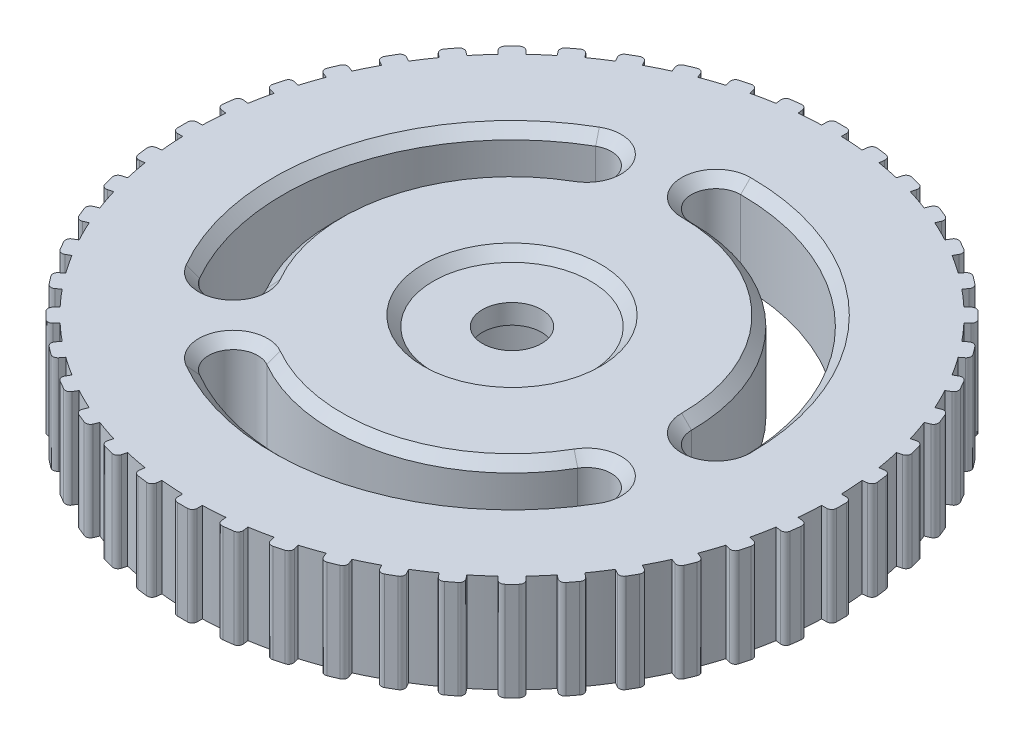
from build123d import *

# Parameters (mm, degrees)
SKETCH1_R              = 65
SKETCH1_R_2            = 18.5
BOSS_EXTRUDE1_DEPTH    = 20
BOSS_EXTRUDE1_2_DEPTH  = 20
BOSS_EXTRUDE1_3_DEPTH  = 20
BOSS_EXTRUDE1_4_DEPTH  = 20
BOSS_EXTRUDE1_5_DEPTH  = 20
BOSS_EXTRUDE1_6_DEPTH  = 20
BOSS_EXTRUDE1_7_DEPTH  = 20
BOSS_EXTRUDE1_8_DEPTH  = 20
BOSS_EXTRUDE1_9_DEPTH  = 20
BOSS_EXTRUDE1_10_DEPTH = 20
BOSS_EXTRUDE1_11_DEPTH = 20
BOSS_EXTRUDE1_12_DEPTH = 20
BOSS_EXTRUDE1_13_DEPTH = 20
BOSS_EXTRUDE1_14_DEPTH = 20
BOSS_EXTRUDE1_15_DEPTH = 20
BOSS_EXTRUDE1_16_DEPTH = 20
BOSS_EXTRUDE1_17_DEPTH = 20
BOSS_EXTRUDE1_18_DEPTH = 20
BOSS_EXTRUDE1_19_DEPTH = 20
BOSS_EXTRUDE1_20_DEPTH = 20
BOSS_EXTRUDE1_21_DEPTH = 20
BOSS_EXTRUDE1_22_DEPTH = 20
BOSS_EXTRUDE1_23_DEPTH = 20
BOSS_EXTRUDE1_24_DEPTH = 20
BOSS_EXTRUDE1_25_DEPTH = 20
BOSS_EXTRUDE1_26_DEPTH = 20
BOSS_EXTRUDE1_27_DEPTH = 20
BOSS_EXTRUDE1_28_DEPTH = 20
BOSS_EXTRUDE1_29_DEPTH = 20
BOSS_EXTRUDE1_30_DEPTH = 20
BOSS_EXTRUDE1_31_DEPTH = 20
BOSS_EXTRUDE1_32_DEPTH = 20
BOSS_EXTRUDE1_33_DEPTH = 20
BOSS_EXTRUDE1_34_DEPTH = 20
BOSS_EXTRUDE1_35_DEPTH = 20
BOSS_EXTRUDE1_36_DEPTH = 20
BOSS_EXTRUDE1_37_DEPTH = 20
BOSS_EXTRUDE1_38_DEPTH = 20
BOSS_EXTRUDE1_39_DEPTH = 20
BOSS_EXTRUDE1_40_DEPTH = 20
BOSS_EXTRUDE1_41_DEPTH = 20
BOSS_EXTRUDE1_42_DEPTH = 20
BOSS_EXTRUDE1_43_DEPTH = 20
BOSS_EXTRUDE1_44_DEPTH = 20
BOSS_EXTRUDE1_45_DEPTH = 20
BOSS_EXTRUDE1_46_DEPTH = 20
BOSS_EXTRUDE1_47_DEPTH = 20
BOSS_EXTRUDE1_48_DEPTH = 20
BOSS_EXTRUDE1_49_DEPTH = 20
SKETCH2_W              = 4
SKETCH2_H              = 1.896098486
SKETCH2_W_2            = 1.896098486
SKETCH2_H_2            = 4
BOSS_EXTRUDE2_DEPTH    = 20
SKETCH3_R              = 18.5
BOSS_EXTRUDE3_DEPTH    = 20
SKETCH4_R              = 17
CUT_EXTRUDE1_DEPTH     = 14
CHAMFER1_SIZE          = 6
SKETCH5_R              = 6
CUT_EXTRUDE2_DEPTH     = 14
SKETCH6_R              = 12
CUT_EXTRUDE3_DEPTH     = 2
CHAMFER2_SIZE          = 6
CUT_EXTRUDE4_DEPTH     = 20
CHAMFER3_SIZE          = 2


with BuildPart() as part:
    # Sketch1 → Boss-Extrude1 (new body)
    with BuildSketch(Plane(origin=(0, 0, 0), x_dir=(1, 0, 0), z_dir=(0, 1, 0))):
        with Locations(Location((0, 0, 0), (0, 0, 270))):
            Circle(SKETCH1_R)
        with Locations(Location((0, 0, 0), (0, 0, 270))):
            Circle(SKETCH1_R_2, mode=Mode.SUBTRACT)
    extrude(amount=BOSS_EXTRUDE1_DEPTH)



with BuildPart() as body_2:
    # Sketch1 → Boss-Extrude1 2 (new body)
    with BuildSketch(Plane(origin=(0, 0, 0), x_dir=(1, 0, 0), z_dir=(0, 1, 0))):
        with BuildLine():
            ThreePointArc((-31.267949192, -58.15767665), (-31.875155551, -58.623602476), (-32.633974596, -58.523702054))
            Line((-32.633974596, -58.523702054), (-34.366025404, -57.523702054))
            ThreePointArc((-34.366025404, -57.523702054), (-34.83195123, -56.916495695), (-34.732050808, -56.15767665))
            Line((-34.732050808, -56.15767665), (-34.232050808, -55.291651246))
            Line((-34.232050808, -55.291651246), (-32.5, -56.291651246))
            Line((-32.5, -56.291651246), (-30.767949192, -57.291651246))
            Line((-30.767949192, -57.291651246), (-31.267949192, -58.15767665))
        make_face()
    extrude(amount=BOSS_EXTRUDE1_2_DEPTH)


with BuildPart() as body_3:
    # Sketch1 → Boss-Extrude1 3 (new body)
    with BuildSketch(Plane(origin=(0, 0, 0), x_dir=(1, 0, 0), z_dir=(0, 1, 0))):
        with BuildLine():
            ThreePointArc((-38.591547634, -53.578843317), (-39.254374782, -53.96152675), (-39.993662403, -53.763435229))
            Line((-39.993662403, -53.763435229), (-41.580369084, -52.545912371))
            ThreePointArc((-41.580369084, -52.545912371), (-41.963052516, -51.883085222), (-41.764960995, -51.143797601))
            Line((-41.764960995, -51.143797601), (-41.156199566, -50.350444261))
            Line((-41.156199566, -50.350444261), (-39.569492886, -51.567967119))
            Line((-39.569492886, -51.567967119), (-37.982786205, -52.785489977))
            Line((-37.982786205, -52.785489977), (-38.591547634, -53.578843317))
        make_face()
    extrude(amount=BOSS_EXTRUDE1_3_DEPTH)


with BuildPart() as body_4:
    # Sketch1 → Boss-Extrude1 4 (new body)
    with BuildSketch(Plane(origin=(0, 0, 0), x_dir=(1, 0, 0), z_dir=(0, 1, 0))):
        with BuildLine():
            ThreePointArc((-23.409347471, -61.74141601), (-23.950543571, -62.282612111), (-24.715910436, -62.282612111))
            Line((-24.715910436, -62.282612111), (-26.563669501, -61.517245246))
            ThreePointArc((-26.563669501, -61.517245246), (-27.104865601, -60.976049146), (-27.104865601, -60.210682281))
            Line((-27.104865601, -60.210682281), (-26.722182169, -59.286802749))
            Line((-26.722182169, -59.286802749), (-24.874423104, -60.052169613))
            Line((-24.874423104, -60.052169613), (-23.026664039, -60.817536478))
            Line((-23.026664039, -60.817536478), (-23.409347471, -61.74141601))
        make_face()
    extrude(amount=BOSS_EXTRUDE1_4_DEPTH)


with BuildPart() as body_5:
    # Sketch1 → Boss-Extrude1 5 (new body)
    with BuildSketch(Plane(origin=(0, 0, 0), x_dir=(1, 0, 0), z_dir=(0, 1, 0))):
        with BuildLine():
            ThreePointArc((-15.150205324, -64.268742625), (-15.61613115, -64.875948984), (-16.374950196, -64.975849406))
            Line((-16.374950196, -64.975849406), (-18.306801848, -64.458211316))
            ThreePointArc((-18.306801848, -64.458211316), (-18.914008207, -63.99228549), (-19.013908629, -63.233466445))
            Line((-19.013908629, -63.233466445), (-18.755089584, -62.267540619))
            Line((-18.755089584, -62.267540619), (-16.823237932, -62.785178709))
            Line((-16.823237932, -62.785178709), (-14.891386279, -63.302816799))
            Line((-14.891386279, -63.302816799), (-15.150205324, -64.268742625))
        make_face()
    extrude(amount=BOSS_EXTRUDE1_5_DEPTH)


with BuildPart() as body_6:
    # Sketch1 → Boss-Extrude1 6 (new body)
    with BuildSketch(Plane(origin=(0, 0, 0), x_dir=(1, 0, 0), z_dir=(0, 1, 0))):
        with BuildLine():
            ThreePointArc((-6.631838964, -65.696413235), (-7.014522396, -66.359240383), (-7.753810017, -66.557331904))
            Line((-7.753810017, -66.557331904), (-9.73669974, -66.29627952))
            ThreePointArc((-9.73669974, -66.29627952), (-10.399526888, -65.913596087), (-10.597618409, -65.174308466))
            Line((-10.597618409, -65.174308466), (-10.467092217, -64.182863605))
            Line((-10.467092217, -64.182863605), (-8.484202494, -64.443915989))
            Line((-8.484202494, -64.443915989), (-6.501312772, -64.704968374))
            Line((-6.501312772, -64.704968374), (-6.631838964, -65.696413235))
        make_face()
    extrude(amount=BOSS_EXTRUDE1_6_DEPTH)


with BuildPart() as body_7:
    # Sketch1 → Boss-Extrude1 7 (new body)
    with BuildSketch(Plane(origin=(0, 0, 0), x_dir=(1, 0, 0), z_dir=(0, 1, 0))):
        with BuildLine():
            ThreePointArc((2, -66), (1.707106781, -66.707106781), (1, -67))
            Line((1, -67), (-1, -67))
            ThreePointArc((-1, -67), (-1.707106781, -66.707106781), (-2, -66))
            Line((-2, -66), (-2, -65))
            Line((-2, -65), (0, -65))
            Line((0, -65), (2, -65))
            Line((2, -65), (2, -66))
        make_face()
    extrude(amount=BOSS_EXTRUDE1_7_DEPTH)


with BuildPart() as body_8:
    # Sketch1 → Boss-Extrude1 8 (new body)
    with BuildSketch(Plane(origin=(0, 0, 0), x_dir=(1, 0, 0), z_dir=(0, 1, 0))):
        with BuildLine():
            ThreePointArc((10.597618409, -65.174308466), (10.399526888, -65.913596087), (9.73669974, -66.29627952))
            Line((9.73669974, -66.29627952), (7.753810017, -66.557331904))
            ThreePointArc((7.753810017, -66.557331904), (7.014522396, -66.359240383), (6.631838964, -65.696413235))
            Line((6.631838964, -65.696413235), (6.501312772, -64.704968374))
            Line((6.501312772, -64.704968374), (8.484202494, -64.443915989))
            Line((8.484202494, -64.443915989), (10.467092217, -64.182863605))
            Line((10.467092217, -64.182863605), (10.597618409, -65.174308466))
        make_face()
    extrude(amount=BOSS_EXTRUDE1_8_DEPTH)


with BuildPart() as body_9:
    # Sketch1 → Boss-Extrude1 9 (new body)
    with BuildSketch(Plane(origin=(0, 0, 0), x_dir=(1, 0, 0), z_dir=(0, 1, 0))):
        with BuildLine():
            ThreePointArc((27.104865601, -60.210682281), (27.104865601, -60.976049146), (26.563669501, -61.517245246))
            Line((26.563669501, -61.517245246), (24.715910436, -62.282612111))
            ThreePointArc((24.715910436, -62.282612111), (23.950543571, -62.282612111), (23.409347471, -61.74141601))
            Line((23.409347471, -61.74141601), (23.026664039, -60.817536478))
            Line((23.026664039, -60.817536478), (24.874423104, -60.052169613))
            Line((24.874423104, -60.052169613), (26.722182169, -59.286802749))
            Line((26.722182169, -59.286802749), (27.104865601, -60.210682281))
        make_face()
    extrude(amount=BOSS_EXTRUDE1_9_DEPTH)


with BuildPart() as body_10:
    # Sketch1 → Boss-Extrude1 10 (new body)
    with BuildSketch(Plane(origin=(0, 0, 0), x_dir=(1, 0, 0), z_dir=(0, 1, 0))):
        with BuildLine():
            ThreePointArc((34.732050808, -56.15767665), (34.83195123, -56.916495695), (34.366025404, -57.523702054))
            Line((34.366025404, -57.523702054), (32.633974596, -58.523702054))
            ThreePointArc((32.633974596, -58.523702054), (31.875155551, -58.623602476), (31.267949192, -58.15767665))
            Line((31.267949192, -58.15767665), (30.767949192, -57.291651246))
            Line((30.767949192, -57.291651246), (32.5, -56.291651246))
            Line((32.5, -56.291651246), (34.232050808, -55.291651246))
            Line((34.232050808, -55.291651246), (34.732050808, -56.15767665))
        make_face()
    extrude(amount=BOSS_EXTRUDE1_10_DEPTH)


with BuildPart() as body_11:
    # Sketch1 → Boss-Extrude1 11 (new body)
    with BuildSketch(Plane(origin=(0, 0, 0), x_dir=(1, 0, 0), z_dir=(0, 1, 0))):
        with BuildLine():
            ThreePointArc((41.764960995, -51.143797601), (41.963052516, -51.883085222), (41.580369084, -52.545912371))
            Line((41.580369084, -52.545912371), (39.993662403, -53.763435229))
            ThreePointArc((39.993662403, -53.763435229), (39.254374782, -53.96152675), (38.591547634, -53.578843317))
            Line((38.591547634, -53.578843317), (37.982786205, -52.785489977))
            Line((37.982786205, -52.785489977), (39.569492886, -51.567967119))
            Line((39.569492886, -51.567967119), (41.156199566, -50.350444261))
            Line((41.156199566, -50.350444261), (41.764960995, -51.143797601))
        make_face()
    extrude(amount=BOSS_EXTRUDE1_11_DEPTH)


with BuildPart() as body_12:
    # Sketch1 → Boss-Extrude1 12 (new body)
    with BuildSketch(Plane(origin=(0, 0, 0), x_dir=(1, 0, 0), z_dir=(0, 1, 0))):
        with BuildLine():
            ThreePointArc((48.083261121, -45.254833996), (48.37615434, -45.961940777), (48.083261121, -46.669047558))
            Line((48.083261121, -46.669047558), (46.669047558, -48.083261121))
            ThreePointArc((46.669047558, -48.083261121), (45.961940777, -48.376154339), (45.254833996, -48.083261121))
            Line((45.254833996, -48.083261121), (44.547727215, -47.376154339))
            Line((44.547727215, -47.376154339), (45.961940777, -45.961940777))
            Line((45.961940777, -45.961940777), (47.37615434, -44.547727215))
            Line((47.37615434, -44.547727215), (48.083261121, -45.254833996))
        make_face()
    extrude(amount=BOSS_EXTRUDE1_12_DEPTH)


with BuildPart() as body_13:
    # Sketch1 → Boss-Extrude1 13 (new body)
    with BuildSketch(Plane(origin=(0, 0, 0), x_dir=(1, 0, 0), z_dir=(0, 1, 0))):
        with BuildLine():
            ThreePointArc((53.578843317, -38.591547634), (53.96152675, -39.254374782), (53.763435229, -39.993662403))
            Line((53.763435229, -39.993662403), (52.545912371, -41.580369084))
            ThreePointArc((52.545912371, -41.580369084), (51.883085222, -41.963052516), (51.143797601, -41.764960995))
            Line((51.143797601, -41.764960995), (50.350444261, -41.156199566))
            Line((50.350444261, -41.156199566), (51.567967119, -39.569492886))
            Line((51.567967119, -39.569492886), (52.785489977, -37.982786205))
            Line((52.785489977, -37.982786205), (53.578843317, -38.591547634))
        make_face()
    extrude(amount=BOSS_EXTRUDE1_13_DEPTH)


with BuildPart() as body_14:
    # Sketch1 → Boss-Extrude1 14 (new body)
    with BuildSketch(Plane(origin=(0, 0, 0), x_dir=(1, 0, 0), z_dir=(0, 1, 0))):
        with BuildLine():
            ThreePointArc((58.15767665, -31.267949192), (58.623602476, -31.875155551), (58.523702054, -32.633974596))
            Line((58.523702054, -32.633974596), (57.523702054, -34.366025404))
            ThreePointArc((57.523702054, -34.366025404), (56.916495695, -34.83195123), (56.15767665, -34.732050808))
            Line((56.15767665, -34.732050808), (55.291651246, -34.232050808))
            Line((55.291651246, -34.232050808), (56.291651246, -32.5))
            Line((56.291651246, -32.5), (57.291651246, -30.767949192))
            Line((57.291651246, -30.767949192), (58.15767665, -31.267949192))
        make_face()
    extrude(amount=BOSS_EXTRUDE1_14_DEPTH)


with BuildPart() as body_15:
    # Sketch1 → Boss-Extrude1 15 (new body)
    with BuildSketch(Plane(origin=(0, 0, 0), x_dir=(1, 0, 0), z_dir=(0, 1, 0))):
        with BuildLine():
            ThreePointArc((61.74141601, -23.409347471), (62.282612111, -23.950543571), (62.282612111, -24.715910436))
            Line((62.282612111, -24.715910436), (61.517245246, -26.563669501))
            ThreePointArc((61.517245246, -26.563669501), (60.976049146, -27.104865601), (60.210682281, -27.104865601))
            Line((60.210682281, -27.104865601), (59.286802749, -26.722182169))
            Line((59.286802749, -26.722182169), (60.052169613, -24.874423104))
            Line((60.052169613, -24.874423104), (60.817536478, -23.026664039))
            Line((60.817536478, -23.026664039), (61.74141601, -23.409347471))
        make_face()
    extrude(amount=BOSS_EXTRUDE1_15_DEPTH)


with BuildPart() as body_16:
    # Sketch1 → Boss-Extrude1 16 (new body)
    with BuildSketch(Plane(origin=(0, 0, 0), x_dir=(1, 0, 0), z_dir=(0, 1, 0))):
        with BuildLine():
            ThreePointArc((64.268742625, -15.150205324), (64.875948984, -15.61613115), (64.975849406, -16.374950196))
            Line((64.975849406, -16.374950196), (64.458211316, -18.306801848))
            ThreePointArc((64.458211316, -18.306801848), (63.99228549, -18.914008207), (63.233466445, -19.013908629))
            Line((63.233466445, -19.013908629), (62.267540619, -18.755089584))
            Line((62.267540619, -18.755089584), (62.785178709, -16.823237932))
            Line((62.785178709, -16.823237932), (63.302816799, -14.891386279))
            Line((63.302816799, -14.891386279), (64.268742625, -15.150205324))
        make_face()
    extrude(amount=BOSS_EXTRUDE1_16_DEPTH)


with BuildPart() as body_17:
    # Sketch1 → Boss-Extrude1 17 (new body)
    with BuildSketch(Plane(origin=(0, 0, 0), x_dir=(1, 0, 0), z_dir=(0, 1, 0))):
        with BuildLine():
            ThreePointArc((65.696413235, -6.631838964), (66.359240383, -7.014522396), (66.557331904, -7.753810017))
            Line((66.557331904, -7.753810017), (66.29627952, -9.73669974))
            ThreePointArc((66.29627952, -9.73669974), (65.913596087, -10.399526888), (65.174308466, -10.597618409))
            Line((65.174308466, -10.597618409), (64.182863605, -10.467092217))
            Line((64.182863605, -10.467092217), (64.443915989, -8.484202494))
            Line((64.443915989, -8.484202494), (64.704968374, -6.501312772))
            Line((64.704968374, -6.501312772), (65.696413235, -6.631838964))
        make_face()
    extrude(amount=BOSS_EXTRUDE1_17_DEPTH)


with BuildPart() as body_18:
    # Sketch1 → Boss-Extrude1 18 (new body)
    with BuildSketch(Plane(origin=(0, 0, 0), x_dir=(1, 0, 0), z_dir=(0, 1, 0))):
        with BuildLine():
            ThreePointArc((66, 2), (66.707106781, 1.707106781), (67, 1))
            Line((67, 1), (67, -1))
            ThreePointArc((67, -1), (66.707106781, -1.707106781), (66, -2))
            Line((66, -2), (65, -2))
            Line((65, -2), (65, 0))
            Line((65, 0), (65, 2))
            Line((65, 2), (66, 2))
        make_face()
    extrude(amount=BOSS_EXTRUDE1_18_DEPTH)


with BuildPart() as body_19:
    # Sketch1 → Boss-Extrude1 19 (new body)
    with BuildSketch(Plane(origin=(0, 0, 0), x_dir=(1, 0, 0), z_dir=(0, 1, 0))):
        with BuildLine():
            ThreePointArc((65.174308466, 10.597618409), (65.913596087, 10.399526888), (66.29627952, 9.73669974))
            Line((66.29627952, 9.73669974), (66.557331904, 7.753810017))
            ThreePointArc((66.557331904, 7.753810017), (66.359240383, 7.014522396), (65.696413235, 6.631838964))
            Line((65.696413235, 6.631838964), (64.704968374, 6.501312772))
            Line((64.704968374, 6.501312772), (64.443915989, 8.484202494))
            Line((64.443915989, 8.484202494), (64.182863605, 10.467092217))
            Line((64.182863605, 10.467092217), (65.174308466, 10.597618409))
        make_face()
    extrude(amount=BOSS_EXTRUDE1_19_DEPTH)


with BuildPart() as body_20:
    # Sketch1 → Boss-Extrude1 20 (new body)
    with BuildSketch(Plane(origin=(0, 0, 0), x_dir=(1, 0, 0), z_dir=(0, 1, 0))):
        with BuildLine():
            ThreePointArc((60.210682281, 27.104865601), (60.976049146, 27.104865601), (61.517245246, 26.563669501))
            Line((61.517245246, 26.563669501), (62.282612111, 24.715910436))
            ThreePointArc((62.282612111, 24.715910436), (62.282612111, 23.950543571), (61.74141601, 23.409347471))
            Line((61.74141601, 23.409347471), (60.817536478, 23.026664039))
            Line((60.817536478, 23.026664039), (60.052169613, 24.874423104))
            Line((60.052169613, 24.874423104), (59.286802749, 26.722182169))
            Line((59.286802749, 26.722182169), (60.210682281, 27.104865601))
        make_face()
    extrude(amount=BOSS_EXTRUDE1_20_DEPTH)


with BuildPart() as body_21:
    # Sketch1 → Boss-Extrude1 21 (new body)
    with BuildSketch(Plane(origin=(0, 0, 0), x_dir=(1, 0, 0), z_dir=(0, 1, 0))):
        with BuildLine():
            ThreePointArc((56.15767665, 34.732050808), (56.916495695, 34.83195123), (57.523702054, 34.366025404))
            Line((57.523702054, 34.366025404), (58.523702054, 32.633974596))
            ThreePointArc((58.523702054, 32.633974596), (58.623602476, 31.875155551), (58.15767665, 31.267949192))
            Line((58.15767665, 31.267949192), (57.291651246, 30.767949192))
            Line((57.291651246, 30.767949192), (56.291651246, 32.5))
            Line((56.291651246, 32.5), (55.291651246, 34.232050808))
            Line((55.291651246, 34.232050808), (56.15767665, 34.732050808))
        make_face()
    extrude(amount=BOSS_EXTRUDE1_21_DEPTH)


with BuildPart() as body_22:
    # Sketch1 → Boss-Extrude1 22 (new body)
    with BuildSketch(Plane(origin=(0, 0, 0), x_dir=(1, 0, 0), z_dir=(0, 1, 0))):
        with BuildLine():
            ThreePointArc((51.143797601, 41.764960995), (51.883085222, 41.963052516), (52.545912371, 41.580369084))
            Line((52.545912371, 41.580369084), (53.763435229, 39.993662403))
            ThreePointArc((53.763435229, 39.993662403), (53.96152675, 39.254374782), (53.578843317, 38.591547634))
            Line((53.578843317, 38.591547634), (52.785489977, 37.982786205))
            Line((52.785489977, 37.982786205), (51.567967119, 39.569492886))
            Line((51.567967119, 39.569492886), (50.350444261, 41.156199566))
            Line((50.350444261, 41.156199566), (51.143797601, 41.764960995))
        make_face()
    extrude(amount=BOSS_EXTRUDE1_22_DEPTH)


with BuildPart() as body_23:
    # Sketch1 → Boss-Extrude1 23 (new body)
    with BuildSketch(Plane(origin=(0, 0, 0), x_dir=(1, 0, 0), z_dir=(0, 1, 0))):
        with BuildLine():
            ThreePointArc((45.254833996, 48.083261121), (45.961940777, 48.376154339), (46.669047558, 48.083261121))
            Line((46.669047558, 48.083261121), (48.083261121, 46.669047558))
            ThreePointArc((48.083261121, 46.669047558), (48.376154339, 45.961940777), (48.083261121, 45.254833996))
            Line((48.083261121, 45.254833996), (47.376154339, 44.547727215))
            Line((47.376154339, 44.547727215), (45.961940777, 45.961940777))
            Line((45.961940777, 45.961940777), (44.547727215, 47.376154339))
            Line((44.547727215, 47.376154339), (45.254833996, 48.083261121))
        make_face()
    extrude(amount=BOSS_EXTRUDE1_23_DEPTH)


with BuildPart() as body_24:
    # Sketch1 → Boss-Extrude1 24 (new body)
    with BuildSketch(Plane(origin=(0, 0, 0), x_dir=(1, 0, 0), z_dir=(0, 1, 0))):
        with BuildLine():
            ThreePointArc((38.591547634, 53.578843317), (39.254374782, 53.96152675), (39.993662403, 53.763435229))
            Line((39.993662403, 53.763435229), (41.580369084, 52.545912371))
            ThreePointArc((41.580369084, 52.545912371), (41.963052516, 51.883085222), (41.764960995, 51.143797601))
            Line((41.764960995, 51.143797601), (41.156199566, 50.350444261))
            Line((41.156199566, 50.350444261), (39.569492886, 51.567967119))
            Line((39.569492886, 51.567967119), (37.982786205, 52.785489977))
            Line((37.982786205, 52.785489977), (38.591547634, 53.578843317))
        make_face()
    extrude(amount=BOSS_EXTRUDE1_24_DEPTH)


with BuildPart() as body_25:
    # Sketch1 → Boss-Extrude1 25 (new body)
    with BuildSketch(Plane(origin=(0, 0, 0), x_dir=(1, 0, 0), z_dir=(0, 1, 0))):
        with BuildLine():
            ThreePointArc((31.267949192, 58.15767665), (31.875155551, 58.623602476), (32.633974596, 58.523702054))
            Line((32.633974596, 58.523702054), (34.366025404, 57.523702054))
            ThreePointArc((34.366025404, 57.523702054), (34.83195123, 56.916495695), (34.732050808, 56.15767665))
            Line((34.732050808, 56.15767665), (34.232050808, 55.291651246))
            Line((34.232050808, 55.291651246), (32.5, 56.291651246))
            Line((32.5, 56.291651246), (30.767949192, 57.291651246))
            Line((30.767949192, 57.291651246), (31.267949192, 58.15767665))
        make_face()
    extrude(amount=BOSS_EXTRUDE1_25_DEPTH)


with BuildPart() as body_26:
    # Sketch1 → Boss-Extrude1 26 (new body)
    with BuildSketch(Plane(origin=(0, 0, 0), x_dir=(1, 0, 0), z_dir=(0, 1, 0))):
        with BuildLine():
            ThreePointArc((23.409347471, 61.74141601), (23.950543571, 62.282612111), (24.715910436, 62.282612111))
            Line((24.715910436, 62.282612111), (26.563669501, 61.517245246))
            ThreePointArc((26.563669501, 61.517245246), (27.104865601, 60.976049146), (27.104865601, 60.210682281))
            Line((27.104865601, 60.210682281), (26.722182169, 59.286802749))
            Line((26.722182169, 59.286802749), (24.874423104, 60.052169613))
            Line((24.874423104, 60.052169613), (23.026664039, 60.817536478))
            Line((23.026664039, 60.817536478), (23.409347471, 61.74141601))
        make_face()
    extrude(amount=BOSS_EXTRUDE1_26_DEPTH)


with BuildPart() as body_27:
    # Sketch1 → Boss-Extrude1 27 (new body)
    with BuildSketch(Plane(origin=(0, 0, 0), x_dir=(1, 0, 0), z_dir=(0, 1, 0))):
        with BuildLine():
            ThreePointArc((15.150205324, 64.268742625), (15.61613115, 64.875948984), (16.374950196, 64.975849406))
            Line((16.374950196, 64.975849406), (18.306801848, 64.458211316))
            ThreePointArc((18.306801848, 64.458211316), (18.914008207, 63.99228549), (19.013908629, 63.233466445))
            Line((19.013908629, 63.233466445), (18.755089584, 62.267540619))
            Line((18.755089584, 62.267540619), (16.823237932, 62.785178709))
            Line((16.823237932, 62.785178709), (14.891386279, 63.302816799))
            Line((14.891386279, 63.302816799), (15.150205324, 64.268742625))
        make_face()
    extrude(amount=BOSS_EXTRUDE1_27_DEPTH)


with BuildPart() as body_28:
    # Sketch1 → Boss-Extrude1 28 (new body)
    with BuildSketch(Plane(origin=(0, 0, 0), x_dir=(1, 0, 0), z_dir=(0, 1, 0))):
        with BuildLine():
            ThreePointArc((6.631838964, 65.696413235), (7.014522396, 66.359240383), (7.753810017, 66.557331904))
            Line((7.753810017, 66.557331904), (9.73669974, 66.29627952))
            ThreePointArc((9.73669974, 66.29627952), (10.399526888, 65.913596087), (10.597618409, 65.174308466))
            Line((10.597618409, 65.174308466), (10.467092217, 64.182863605))
            Line((10.467092217, 64.182863605), (8.484202494, 64.443915989))
            Line((8.484202494, 64.443915989), (6.501312772, 64.704968374))
            Line((6.501312772, 64.704968374), (6.631838964, 65.696413235))
        make_face()
    extrude(amount=BOSS_EXTRUDE1_28_DEPTH)


with BuildPart() as body_29:
    # Sketch1 → Boss-Extrude1 29 (new body)
    with BuildSketch(Plane(origin=(0, 0, 0), x_dir=(1, 0, 0), z_dir=(0, 1, 0))):
        with BuildLine():
            ThreePointArc((1, 67), (1.707106781, 66.707106781), (2, 66))
            Line((2, 66), (2, 65))
            Line((2, 65), (0, 65))
            Line((0, 65), (-2, 65))
            Line((-2, 65), (-2, 66))
            ThreePointArc((-2, 66), (-1.707106781, 66.707106781), (-1, 67))
            Line((-1, 67), (1, 67))
        make_face()
    extrude(amount=BOSS_EXTRUDE1_29_DEPTH)


with BuildPart() as body_30:
    # Sketch1 → Boss-Extrude1 30 (new body)
    with BuildSketch(Plane(origin=(0, 0, 0), x_dir=(1, 0, 0), z_dir=(0, 1, 0))):
        with BuildLine():
            ThreePointArc((-10.597618409, 65.174308466), (-10.399526888, 65.913596087), (-9.73669974, 66.29627952))
            Line((-9.73669974, 66.29627952), (-7.753810017, 66.557331904))
            ThreePointArc((-7.753810017, 66.557331904), (-7.014522396, 66.359240383), (-6.631838964, 65.696413235))
            Line((-6.631838964, 65.696413235), (-6.501312772, 64.704968374))
            Line((-6.501312772, 64.704968374), (-8.484202494, 64.443915989))
            Line((-8.484202494, 64.443915989), (-10.467092217, 64.182863605))
            Line((-10.467092217, 64.182863605), (-10.597618409, 65.174308466))
        make_face()
    extrude(amount=BOSS_EXTRUDE1_30_DEPTH)


with BuildPart() as body_31:
    # Sketch1 → Boss-Extrude1 31 (new body)
    with BuildSketch(Plane(origin=(0, 0, 0), x_dir=(1, 0, 0), z_dir=(0, 1, 0))):
        with BuildLine():
            ThreePointArc((-19.013908629, 63.233466445), (-18.914008207, 63.99228549), (-18.306801848, 64.458211316))
            Line((-18.306801848, 64.458211316), (-16.374950196, 64.975849406))
            ThreePointArc((-16.374950196, 64.975849406), (-15.61613115, 64.875948984), (-15.150205324, 64.268742625))
            Line((-15.150205324, 64.268742625), (-14.891386279, 63.302816799))
            Line((-14.891386279, 63.302816799), (-16.823237932, 62.785178709))
            Line((-16.823237932, 62.785178709), (-18.755089584, 62.267540619))
            Line((-18.755089584, 62.267540619), (-19.013908629, 63.233466445))
        make_face()
    extrude(amount=BOSS_EXTRUDE1_31_DEPTH)


with BuildPart() as body_32:
    # Sketch1 → Boss-Extrude1 32 (new body)
    with BuildSketch(Plane(origin=(0, 0, 0), x_dir=(1, 0, 0), z_dir=(0, 1, 0))):
        with BuildLine():
            ThreePointArc((-41.764960995, 51.143797601), (-41.963052516, 51.883085222), (-41.580369084, 52.545912371))
            Line((-41.580369084, 52.545912371), (-39.993662403, 53.763435229))
            ThreePointArc((-39.993662403, 53.763435229), (-39.254374782, 53.96152675), (-38.591547634, 53.578843317))
            Line((-38.591547634, 53.578843317), (-37.982786205, 52.785489977))
            Line((-37.982786205, 52.785489977), (-39.569492886, 51.567967119))
            Line((-39.569492886, 51.567967119), (-41.156199566, 50.350444261))
            Line((-41.156199566, 50.350444261), (-41.764960995, 51.143797601))
        make_face()
    extrude(amount=BOSS_EXTRUDE1_32_DEPTH)


with BuildPart() as body_33:
    # Sketch1 → Boss-Extrude1 33 (new body)
    with BuildSketch(Plane(origin=(0, 0, 0), x_dir=(1, 0, 0), z_dir=(0, 1, 0))):
        with BuildLine():
            ThreePointArc((-34.732050808, 56.15767665), (-34.83195123, 56.916495695), (-34.366025404, 57.523702054))
            Line((-34.366025404, 57.523702054), (-32.633974596, 58.523702054))
            ThreePointArc((-32.633974596, 58.523702054), (-31.875155551, 58.623602476), (-31.267949192, 58.15767665))
            Line((-31.267949192, 58.15767665), (-30.767949192, 57.291651246))
            Line((-30.767949192, 57.291651246), (-32.5, 56.291651246))
            Line((-32.5, 56.291651246), (-34.232050808, 55.291651246))
            Line((-34.232050808, 55.291651246), (-34.732050808, 56.15767665))
        make_face()
    extrude(amount=BOSS_EXTRUDE1_33_DEPTH)


with BuildPart() as body_34:
    # Sketch1 → Boss-Extrude1 34 (new body)
    with BuildSketch(Plane(origin=(0, 0, 0), x_dir=(1, 0, 0), z_dir=(0, 1, 0))):
        with BuildLine():
            ThreePointArc((-27.104865601, 60.210682281), (-27.104865601, 60.976049146), (-26.563669501, 61.517245246))
            Line((-26.563669501, 61.517245246), (-24.715910436, 62.282612111))
            ThreePointArc((-24.715910436, 62.282612111), (-23.950543571, 62.282612111), (-23.409347471, 61.74141601))
            Line((-23.409347471, 61.74141601), (-23.026664039, 60.817536478))
            Line((-23.026664039, 60.817536478), (-24.874423104, 60.052169613))
            Line((-24.874423104, 60.052169613), (-26.722182169, 59.286802749))
            Line((-26.722182169, 59.286802749), (-27.104865601, 60.210682281))
        make_face()
    extrude(amount=BOSS_EXTRUDE1_34_DEPTH)


with BuildPart() as body_35:
    # Sketch1 → Boss-Extrude1 35 (new body)
    with BuildSketch(Plane(origin=(0, 0, 0), x_dir=(1, 0, 0), z_dir=(0, 1, 0))):
        with BuildLine():
            ThreePointArc((-53.578843317, 38.591547634), (-53.96152675, 39.254374782), (-53.763435229, 39.993662403))
            Line((-53.763435229, 39.993662403), (-52.545912371, 41.580369084))
            ThreePointArc((-52.545912371, 41.580369084), (-51.883085222, 41.963052516), (-51.143797601, 41.764960995))
            Line((-51.143797601, 41.764960995), (-50.350444261, 41.156199566))
            Line((-50.350444261, 41.156199566), (-51.567967119, 39.569492886))
            Line((-51.567967119, 39.569492886), (-52.785489977, 37.982786205))
            Line((-52.785489977, 37.982786205), (-53.578843317, 38.591547634))
        make_face()
    extrude(amount=BOSS_EXTRUDE1_35_DEPTH)


with BuildPart() as body_36:
    # Sketch1 → Boss-Extrude1 36 (new body)
    with BuildSketch(Plane(origin=(0, 0, 0), x_dir=(1, 0, 0), z_dir=(0, 1, 0))):
        with BuildLine():
            ThreePointArc((-48.083261121, 45.254833996), (-48.376154339, 45.961940777), (-48.083261121, 46.669047558))
            Line((-48.083261121, 46.669047558), (-46.669047558, 48.083261121))
            ThreePointArc((-46.669047558, 48.083261121), (-45.961940777, 48.376154339), (-45.254833996, 48.083261121))
            Line((-45.254833996, 48.083261121), (-44.547727215, 47.376154339))
            Line((-44.547727215, 47.376154339), (-45.961940777, 45.961940777))
            Line((-45.961940777, 45.961940777), (-47.376154339, 44.547727215))
            Line((-47.376154339, 44.547727215), (-48.083261121, 45.254833996))
        make_face()
    extrude(amount=BOSS_EXTRUDE1_36_DEPTH)


with BuildPart() as body_37:
    # Sketch1 → Boss-Extrude1 37 (new body)
    with BuildSketch(Plane(origin=(0, 0, 0), x_dir=(1, 0, 0), z_dir=(0, 1, 0))):
        with BuildLine():
            ThreePointArc((-58.15767665, 31.267949192), (-58.623602476, 31.875155551), (-58.523702054, 32.633974596))
            Line((-58.523702054, 32.633974596), (-57.523702054, 34.366025404))
            ThreePointArc((-57.523702054, 34.366025404), (-56.916495695, 34.83195123), (-56.15767665, 34.732050808))
            Line((-56.15767665, 34.732050808), (-55.291651246, 34.232050808))
            Line((-55.291651246, 34.232050808), (-56.291651246, 32.5))
            Line((-56.291651246, 32.5), (-57.291651246, 30.767949192))
            Line((-57.291651246, 30.767949192), (-58.15767665, 31.267949192))
        make_face()
    extrude(amount=BOSS_EXTRUDE1_37_DEPTH)


with BuildPart() as body_38:
    # Sketch1 → Boss-Extrude1 38 (new body)
    with BuildSketch(Plane(origin=(0, 0, 0), x_dir=(1, 0, 0), z_dir=(0, 1, 0))):
        with BuildLine():
            ThreePointArc((-65.696413235, 6.631838964), (-66.359240383, 7.014522396), (-66.557331904, 7.753810017))
            Line((-66.557331904, 7.753810017), (-66.29627952, 9.73669974))
            ThreePointArc((-66.29627952, 9.73669974), (-65.913596087, 10.399526888), (-65.174308466, 10.597618409))
            Line((-65.174308466, 10.597618409), (-64.182863605, 10.467092217))
            Line((-64.182863605, 10.467092217), (-64.443915989, 8.484202494))
            Line((-64.443915989, 8.484202494), (-64.704968374, 6.501312772))
            Line((-64.704968374, 6.501312772), (-65.696413235, 6.631838964))
        make_face()
    extrude(amount=BOSS_EXTRUDE1_38_DEPTH)


with BuildPart() as body_39:
    # Sketch1 → Boss-Extrude1 39 (new body)
    with BuildSketch(Plane(origin=(0, 0, 0), x_dir=(1, 0, 0), z_dir=(0, 1, 0))):
        with BuildLine():
            ThreePointArc((-66, -2), (-66.707106781, -1.707106781), (-67, -1))
            Line((-67, -1), (-67, 1))
            ThreePointArc((-67, 1), (-66.707106781, 1.707106781), (-66, 2))
            Line((-66, 2), (-65, 2))
            Line((-65, 2), (-65, 0))
            Line((-65, 0), (-65, -2))
            Line((-65, -2), (-66, -2))
        make_face()
    extrude(amount=BOSS_EXTRUDE1_39_DEPTH)


with BuildPart() as body_40:
    # Sketch1 → Boss-Extrude1 40 (new body)
    with BuildSketch(Plane(origin=(0, 0, 0), x_dir=(1, 0, 0), z_dir=(0, 1, 0))):
        with BuildLine():
            ThreePointArc((-65.174308466, -10.597618409), (-65.913596087, -10.399526888), (-66.29627952, -9.73669974))
            Line((-66.29627952, -9.73669974), (-66.557331904, -7.753810017))
            ThreePointArc((-66.557331904, -7.753810017), (-66.359240383, -7.014522396), (-65.696413235, -6.631838964))
            Line((-65.696413235, -6.631838964), (-64.704968374, -6.501312772))
            Line((-64.704968374, -6.501312772), (-64.443915989, -8.484202494))
            Line((-64.443915989, -8.484202494), (-64.182863605, -10.467092217))
            Line((-64.182863605, -10.467092217), (-65.174308466, -10.597618409))
        make_face()
    extrude(amount=BOSS_EXTRUDE1_40_DEPTH)


with BuildPart() as body_41:
    # Sketch1 → Boss-Extrude1 41 (new body)
    with BuildSketch(Plane(origin=(0, 0, 0), x_dir=(1, 0, 0), z_dir=(0, 1, 0))):
        with BuildLine():
            ThreePointArc((-63.233466445, -19.013908629), (-63.99228549, -18.914008207), (-64.458211316, -18.306801848))
            Line((-64.458211316, -18.306801848), (-64.975849406, -16.374950196))
            ThreePointArc((-64.975849406, -16.374950196), (-64.875948984, -15.61613115), (-64.268742625, -15.150205324))
            Line((-64.268742625, -15.150205324), (-63.302816799, -14.891386279))
            Line((-63.302816799, -14.891386279), (-62.785178709, -16.823237932))
            Line((-62.785178709, -16.823237932), (-62.267540619, -18.755089584))
            Line((-62.267540619, -18.755089584), (-63.233466445, -19.013908629))
        make_face()
    extrude(amount=BOSS_EXTRUDE1_41_DEPTH)


with BuildPart() as body_42:
    # Sketch1 → Boss-Extrude1 42 (new body)
    with BuildSketch(Plane(origin=(0, 0, 0), x_dir=(1, 0, 0), z_dir=(0, 1, 0))):
        with BuildLine():
            ThreePointArc((-60.210682281, -27.104865601), (-60.976049146, -27.104865601), (-61.517245246, -26.563669501))
            Line((-61.517245246, -26.563669501), (-62.282612111, -24.715910436))
            ThreePointArc((-62.282612111, -24.715910436), (-62.282612111, -23.950543571), (-61.74141601, -23.409347471))
            Line((-61.74141601, -23.409347471), (-60.817536478, -23.026664039))
            Line((-60.817536478, -23.026664039), (-60.052169613, -24.874423104))
            Line((-60.052169613, -24.874423104), (-59.286802749, -26.722182169))
            Line((-59.286802749, -26.722182169), (-60.210682281, -27.104865601))
        make_face()
    extrude(amount=BOSS_EXTRUDE1_42_DEPTH)


with BuildPart() as body_43:
    # Sketch1 → Boss-Extrude1 43 (new body)
    with BuildSketch(Plane(origin=(0, 0, 0), x_dir=(1, 0, 0), z_dir=(0, 1, 0))):
        with BuildLine():
            ThreePointArc((-56.15767665, -34.732050808), (-56.916495695, -34.83195123), (-57.523702054, -34.366025404))
            Line((-57.523702054, -34.366025404), (-58.523702054, -32.633974596))
            ThreePointArc((-58.523702054, -32.633974596), (-58.623602476, -31.875155551), (-58.15767665, -31.267949192))
            Line((-58.15767665, -31.267949192), (-57.291651246, -30.767949192))
            Line((-57.291651246, -30.767949192), (-56.291651246, -32.5))
            Line((-56.291651246, -32.5), (-55.291651246, -34.232050808))
            Line((-55.291651246, -34.232050808), (-56.15767665, -34.732050808))
        make_face()
    extrude(amount=BOSS_EXTRUDE1_43_DEPTH)


with BuildPart() as body_44:
    # Sketch1 → Boss-Extrude1 44 (new body)
    with BuildSketch(Plane(origin=(0, 0, 0), x_dir=(1, 0, 0), z_dir=(0, 1, 0))):
        with BuildLine():
            ThreePointArc((-51.143797601, -41.764960995), (-51.883085222, -41.963052516), (-52.545912371, -41.580369084))
            Line((-52.545912371, -41.580369084), (-53.763435229, -39.993662403))
            ThreePointArc((-53.763435229, -39.993662403), (-53.96152675, -39.254374782), (-53.578843317, -38.591547634))
            Line((-53.578843317, -38.591547634), (-52.785489977, -37.982786205))
            Line((-52.785489977, -37.982786205), (-51.567967119, -39.569492886))
            Line((-51.567967119, -39.569492886), (-50.350444261, -41.156199566))
            Line((-50.350444261, -41.156199566), (-51.143797601, -41.764960995))
        make_face()
    extrude(amount=BOSS_EXTRUDE1_44_DEPTH)


with BuildPart() as body_45:
    # Sketch1 → Boss-Extrude1 45 (new body)
    with BuildSketch(Plane(origin=(0, 0, 0), x_dir=(1, 0, 0), z_dir=(0, 1, 0))):
        with BuildLine():
            ThreePointArc((-45.254833996, -48.083261121), (-45.961940777, -48.37615434), (-46.669047558, -48.083261121))
            Line((-46.669047558, -48.083261121), (-48.083261121, -46.669047558))
            ThreePointArc((-48.083261121, -46.669047558), (-48.376154339, -45.961940777), (-48.083261121, -45.254833996))
            Line((-48.083261121, -45.254833996), (-47.376154339, -44.547727215))
            Line((-47.376154339, -44.547727215), (-45.961940777, -45.961940777))
            Line((-45.961940777, -45.961940777), (-44.547727215, -47.37615434))
            Line((-44.547727215, -47.37615434), (-45.254833996, -48.083261121))
        make_face()
    extrude(amount=BOSS_EXTRUDE1_45_DEPTH)


with BuildPart() as body_46:
    # Sketch1 → Boss-Extrude1 46 (new body)
    with BuildSketch(Plane(origin=(0, 0, 0), x_dir=(1, 0, 0), z_dir=(0, 1, 0))):
        with BuildLine():
            Line((16.823237932, -62.785178709), (14.891386279, -63.302816799))
            Line((14.891386279, -63.302816799), (15.150205324, -64.268742625))
            ThreePointArc((15.150205324, -64.268742625), (15.61613115, -64.875948984), (16.374950196, -64.975849406))
            Line((16.374950196, -64.975849406), (18.306801848, -64.458211316))
            ThreePointArc((18.306801848, -64.458211316), (18.914008207, -63.99228549), (19.013908629, -63.233466445))
            Line((19.013908629, -63.233466445), (18.755089584, -62.267540619))
            Line((18.755089584, -62.267540619), (16.823237932, -62.785178709))
        make_face()
    extrude(amount=BOSS_EXTRUDE1_46_DEPTH)


with BuildPart() as body_47:
    # Sketch1 → Boss-Extrude1 47 (new body)
    with BuildSketch(Plane(origin=(0, 0, 0), x_dir=(1, 0, 0), z_dir=(0, 1, 0))):
        with BuildLine():
            Line((62.785178709, 16.823237932), (63.302816799, 14.891386279))
            Line((63.302816799, 14.891386279), (64.268742625, 15.150205324))
            ThreePointArc((64.268742625, 15.150205324), (64.875948984, 15.61613115), (64.975849406, 16.374950196))
            Line((64.975849406, 16.374950196), (64.458211316, 18.306801848))
            ThreePointArc((64.458211316, 18.306801848), (63.99228549, 18.914008207), (63.233466445, 19.013908629))
            Line((63.233466445, 19.013908629), (62.267540619, 18.755089584))
            Line((62.267540619, 18.755089584), (62.785178709, 16.823237932))
        make_face()
    extrude(amount=BOSS_EXTRUDE1_47_DEPTH)


with BuildPart() as body_48:
    # Sketch1 → Boss-Extrude1 48 (new body)
    with BuildSketch(Plane(origin=(0, 0, 0), x_dir=(1, 0, 0), z_dir=(0, 1, 0))):
        with BuildLine():
            Line((-62.282612111, 24.715910436), (-61.517245246, 26.563669501))
            ThreePointArc((-61.517245246, 26.563669501), (-60.976049146, 27.104865601), (-60.210682281, 27.104865601))
            Line((-60.210682281, 27.104865601), (-59.286802749, 26.722182169))
            Line((-59.286802749, 26.722182169), (-60.052169613, 24.874423104))
            Line((-60.052169613, 24.874423104), (-60.817536478, 23.026664039))
            Line((-60.817536478, 23.026664039), (-61.74141601, 23.409347471))
            ThreePointArc((-61.74141601, 23.409347471), (-62.282612111, 23.950543571), (-62.282612111, 24.715910436))
        make_face()
    extrude(amount=BOSS_EXTRUDE1_48_DEPTH)


with BuildPart() as body_49:
    # Sketch1 → Boss-Extrude1 49 (new body)
    with BuildSketch(Plane(origin=(0, 0, 0), x_dir=(1, 0, 0), z_dir=(0, 1, 0))):
        with BuildLine():
            Line((-62.785178709, 16.823237932), (-63.302816799, 14.891386279))
            Line((-63.302816799, 14.891386279), (-64.268742625, 15.150205324))
            ThreePointArc((-64.268742625, 15.150205324), (-64.875948984, 15.61613115), (-64.975849406, 16.374950196))
            Line((-64.975849406, 16.374950196), (-64.458211316, 18.306801848))
            ThreePointArc((-64.458211316, 18.306801848), (-63.99228549, 18.914008207), (-63.233466445, 19.013908629))
            Line((-63.233466445, 19.013908629), (-62.267540619, 18.755089584))
            Line((-62.267540619, 18.755089584), (-62.785178709, 16.823237932))
        make_face()
    extrude(amount=BOSS_EXTRUDE1_49_DEPTH)


with BuildPart() as part_1:
    add(part.part)

    add(body_2.part)  # Boss-Extrude2 merges body 2

    add(body_3.part)  # Boss-Extrude2 merges body 3

    add(body_4.part)  # Boss-Extrude2 merges body 4

    add(body_5.part)  # Boss-Extrude2 merges body 5

    add(body_6.part)  # Boss-Extrude2 merges body 6

    add(body_7.part)  # Boss-Extrude2 merges body 7

    add(body_8.part)  # Boss-Extrude2 merges body 8

    add(body_9.part)  # Boss-Extrude2 merges body 9

    add(body_10.part)  # Boss-Extrude2 merges body 10

    add(body_11.part)  # Boss-Extrude2 merges body 11

    add(body_12.part)  # Boss-Extrude2 merges body 12

    add(body_13.part)  # Boss-Extrude2 merges body 13

    add(body_14.part)  # Boss-Extrude2 merges body 14

    add(body_15.part)  # Boss-Extrude2 merges body 15

    add(body_16.part)  # Boss-Extrude2 merges body 16

    add(body_17.part)  # Boss-Extrude2 merges body 17

    add(body_18.part)  # Boss-Extrude2 merges body 18

    add(body_19.part)  # Boss-Extrude2 merges body 19

    add(body_20.part)  # Boss-Extrude2 merges body 20

    add(body_21.part)  # Boss-Extrude2 merges body 21

    add(body_22.part)  # Boss-Extrude2 merges body 22

    add(body_23.part)  # Boss-Extrude2 merges body 23

    add(body_24.part)  # Boss-Extrude2 merges body 24

    add(body_25.part)  # Boss-Extrude2 merges body 25

    add(body_26.part)  # Boss-Extrude2 merges body 26

    add(body_27.part)  # Boss-Extrude2 merges body 27

    add(body_28.part)  # Boss-Extrude2 merges body 28

    add(body_29.part)  # Boss-Extrude2 merges body 29

    add(body_30.part)  # Boss-Extrude2 merges body 30

    add(body_31.part)  # Boss-Extrude2 merges body 31

    add(body_32.part)  # Boss-Extrude2 merges body 32

    add(body_33.part)  # Boss-Extrude2 merges body 33

    add(body_34.part)  # Boss-Extrude2 merges body 34

    add(body_35.part)  # Boss-Extrude2 merges body 35

    add(body_36.part)  # Boss-Extrude2 merges body 36

    add(body_37.part)  # Boss-Extrude2 merges body 37

    add(body_38.part)  # Boss-Extrude2 merges body 38

    add(body_39.part)  # Boss-Extrude2 merges body 39

    add(body_40.part)  # Boss-Extrude2 merges body 40

    add(body_41.part)  # Boss-Extrude2 merges body 41

    add(body_42.part)  # Boss-Extrude2 merges body 42

    add(body_43.part)  # Boss-Extrude2 merges body 43

    add(body_44.part)  # Boss-Extrude2 merges body 44

    add(body_45.part)  # Boss-Extrude2 merges body 45

    add(body_46.part)  # Boss-Extrude2 merges body 46

    add(body_47.part)  # Boss-Extrude2 merges body 47

    add(body_48.part)  # Boss-Extrude2 merges body 48

    add(body_49.part)  # Boss-Extrude2 merges body 49
    # Sketch2 → Boss-Extrude2 (add)
    with BuildSketch(Plane(origin=(0, 20, 0), x_dir=(1, 0, 0), z_dir=(0, 1, 0))):
        Polygon((6.501312772, 64.704968374), (6.253822256, 62.825091273), (10.219601702, 62.302986504), (10.467092217, 64.182863605), align=None)
        with Locations((0, 64.051950757)):
            Rectangle(SKETCH2_W, SKETCH2_H)
        Polygon((14.891386279, 63.302816799), (14.400639879, 61.471326302), (18.264343185, 60.436050121), (18.755089584, 62.267540619), align=None)
        Polygon((23.026664039, 60.817536478), (22.301058562, 59.065769895), (25.996576692, 57.535036165), (26.722182169, 59.286802749), align=None)
        Polygon((30.767949192, 57.291651246), (29.819899949, 55.649581789), (33.284001564, 53.649581789), (34.232050808, 55.291651246), align=None)
        Polygon((37.982786205, 52.785489977), (36.828514581, 51.281213909), (40.001927942, 48.846168193), (41.156199566, 50.350444261), align=None)
        Polygon((44.547727215, 47.37615434), (43.206983117, 46.035410242), (46.035410242, 43.206983117), (47.376154339, 44.547727215), align=None)
        Polygon((50.350444261, 41.156199566), (48.846168193, 40.001927942), (51.281213909, 36.828514581), (52.785489977, 37.982786205), align=None)
        Polygon((55.291651246, 34.232050808), (53.649581789, 33.284001564), (55.649581789, 29.819899949), (57.291651246, 30.767949192), align=None)
        Polygon((59.286802749, 26.722182169), (57.535036165, 25.996576692), (59.065769895, 22.301058562), (60.817536478, 23.026664039), align=None)
        Polygon((62.267540619, 18.755089584), (60.436050121, 18.264343185), (61.471326302, 14.400639879), (63.302816799, 14.891386279), align=None)
        Polygon((64.182863605, 10.467092217), (62.302986504, 10.219601702), (62.825091273, 6.253822256), (64.704968374, 6.501312772), align=None)
        with Locations((64.051950757, 0)):
            Rectangle(SKETCH2_W_2, SKETCH2_H_2)
        Polygon((64.704968374, -6.501312772), (62.825091273, -6.253822256), (62.302986504, -10.219601702), (64.182863605, -10.467092217), align=None)
        Polygon((63.302816799, -14.891386279), (61.471326302, -14.400639879), (60.436050121, -18.264343185), (62.267540619, -18.755089584), align=None)
        Polygon((60.817536478, -23.026664039), (59.065769895, -22.301058562), (57.535036165, -25.996576692), (59.286802749, -26.722182169), align=None)
        Polygon((57.291651246, -30.767949192), (55.649581789, -29.819899949), (53.649581789, -33.284001564), (55.291651246, -34.232050808), align=None)
        Polygon((52.785489977, -37.982786205), (51.281213909, -36.828514581), (48.846168193, -40.001927942), (50.350444261, -41.156199566), align=None)
        Polygon((47.37615434, -44.547727215), (46.035410242, -43.206983117), (43.206983117, -46.035410242), (44.547727215, -47.376154339), align=None)
        Polygon((41.156199566, -50.350444261), (40.001927942, -48.846168193), (36.828514581, -51.281213909), (37.982786205, -52.785489977), align=None)
        Polygon((34.232050808, -55.291651246), (33.284001564, -53.649581789), (29.819899949, -55.649581789), (30.767949192, -57.291651246), align=None)
        Polygon((26.722182169, -59.286802749), (25.996576692, -57.535036165), (22.301058562, -59.065769895), (23.026664039, -60.817536478), align=None)
        Polygon((18.755089584, -62.267540619), (18.264343185, -60.436050121), (14.400639879, -61.471326302), (14.891386279, -63.302816799), align=None)
        Polygon((10.467092217, -64.182863605), (10.219601702, -62.302986504), (6.253822256, -62.825091273), (6.501312772, -64.704968374), align=None)
        with Locations((0, -64.051950757)):
            Rectangle(SKETCH2_W, SKETCH2_H)
        Polygon((-6.501312772, -64.704968374), (-6.253822256, -62.825091273), (-10.219601702, -62.302986504), (-10.467092217, -64.182863605), align=None)
        Polygon((-14.891386279, -63.302816799), (-14.400639879, -61.471326302), (-18.264343185, -60.436050121), (-18.755089584, -62.267540619), align=None)
        Polygon((-23.026664039, -60.817536478), (-22.301058562, -59.065769895), (-25.996576692, -57.535036165), (-26.722182169, -59.286802749), align=None)
        Polygon((-30.767949192, -57.291651246), (-29.819899949, -55.649581789), (-33.284001564, -53.649581789), (-34.232050808, -55.291651246), align=None)
        Polygon((-37.982786205, -52.785489977), (-36.828514581, -51.281213909), (-40.001927942, -48.846168193), (-41.156199566, -50.350444261), align=None)
        Polygon((-44.547727215, -47.37615434), (-43.206983117, -46.035410242), (-46.035410242, -43.206983117), (-47.376154339, -44.547727215), align=None)
        Polygon((-50.350444261, -41.156199566), (-48.846168193, -40.001927942), (-51.281213909, -36.828514581), (-52.785489977, -37.982786205), align=None)
        Polygon((-55.291651246, -34.232050808), (-53.649581789, -33.284001564), (-55.649581789, -29.819899949), (-57.291651246, -30.767949192), align=None)
        Polygon((-59.286802748, -26.722182169), (-57.535036165, -25.996576692), (-59.065769895, -22.301058562), (-60.817536478, -23.026664039), align=None)
        Polygon((-62.267540619, -18.755089584), (-60.436050121, -18.264343185), (-61.471326302, -14.400639879), (-63.302816799, -14.891386279), align=None)
        Polygon((-64.182863605, -10.467092217), (-62.302986504, -10.219601702), (-62.825091273, -6.253822256), (-64.704968374, -6.501312772), align=None)
        with Locations((-64.051950757, 0)):
            Rectangle(SKETCH2_W_2, SKETCH2_H_2)
        Polygon((-64.704968374, 6.501312772), (-62.825091273, 6.253822256), (-62.302986504, 10.219601702), (-64.182863605, 10.467092217), align=None)
        Polygon((-63.302816799, 14.891386279), (-61.471326302, 14.400639879), (-60.436050121, 18.264343185), (-62.267540619, 18.755089584), align=None)
        Polygon((-60.817536478, 23.026664039), (-59.065769895, 22.301058562), (-57.535036165, 25.996576692), (-59.286802749, 26.722182169), align=None)
        Polygon((-57.291651246, 30.767949192), (-55.649581789, 29.819899949), (-53.649581789, 33.284001564), (-55.291651246, 34.232050808), align=None)
        Polygon((-52.785489977, 37.982786205), (-51.281213909, 36.828514581), (-48.846168193, 40.001927942), (-50.350444261, 41.156199566), align=None)
        Polygon((-47.376154339, 44.547727215), (-46.035410242, 43.206983117), (-43.206983117, 46.035410242), (-44.547727215, 47.376154339), align=None)
        Polygon((-41.156199566, 50.350444261), (-40.001927942, 48.846168193), (-36.828514581, 51.281213909), (-37.982786205, 52.785489977), align=None)
        Polygon((-34.232050808, 55.291651246), (-33.284001564, 53.649581789), (-29.819899949, 55.649581789), (-30.767949192, 57.291651246), align=None)
        Polygon((-26.722182169, 59.286802749), (-25.996576692, 57.535036165), (-22.301058562, 59.065769895), (-23.026664039, 60.817536478), align=None)
        Polygon((-18.755089584, 62.267540619), (-18.264343185, 60.436050121), (-14.400639879, 61.471326302), (-14.891386279, 63.302816799), align=None)
        Polygon((-10.467092217, 64.182863605), (-10.219601702, 62.302986504), (-6.253822256, 62.825091273), (-6.501312772, 64.704968374), align=None)
    extrude(amount=-BOSS_EXTRUDE2_DEPTH)

    # Sketch3 → Boss-Extrude3 (add)
    with BuildSketch(Plane.XZ):
        Circle(SKETCH3_R)
    extrude(amount=-BOSS_EXTRUDE3_DEPTH)

    # Sketch4 → Cut-Extrude1 (cut)
    with BuildSketch(Plane.XZ):
        with Locations(Location((0, 0, 0), (0, 0, 270))):
            Circle(SKETCH4_R)
    extrude(amount=-CUT_EXTRUDE1_DEPTH, mode=Mode.SUBTRACT)

    # Chamfer1
    chamfer1_edges = [part_1.edges().sort_by_distance(p)[0] for p in [
        (0, 14, 17),
    ]]
    chamfer(chamfer1_edges, length=CHAMFER1_SIZE)

    # Sketch5 → Cut-Extrude2 (cut)
    with BuildSketch(Plane.XZ.offset(-14)):
        with Locations(Location((0, 0, 0), (0, 0, 270))):
            Circle(SKETCH5_R)
    extrude(amount=-CUT_EXTRUDE2_DEPTH, mode=Mode.SUBTRACT)

    # Sketch6 → Cut-Extrude3 (cut)
    with BuildSketch(Plane(origin=(0, 20, 0), x_dir=(1, 0, 0), z_dir=(0, 1, 0))):
        with Locations(Location((0, 0, 0), (0, 0, 270))):
            Circle(SKETCH6_R)
    extrude(amount=-CUT_EXTRUDE3_DEPTH, mode=Mode.SUBTRACT)

    # Chamfer2
    # the kernel refuses this chamfer: 6 mm, written as the material it adds along each edge
    # the kernel refuses this chamfer: 6 mm, written as the material it takes off along each edge
    with BuildSketch(Plane(origin=(0, 20, 0), x_dir=(0, 0, 1), z_dir=(-1, 0, 0))) as chamfer2_2_piece_1_section:
        Polygon((12 + CHAMFER2_SIZE, 0), (12, -CHAMFER2_SIZE), (12, 0), align=None)
    chamfer2_2_piece_1 = revolve(axis=Axis((0, 20, 0), (0, 1, 0)), mode=Mode.PRIVATE)
    chamfer2_2_piece_1 = split(chamfer2_2_piece_1, bisect_by=Plane(origin=(0, 18, -16.931398538), z_dir=(0, 1, 0)), keep=Keep.TOP, mode=Mode.PRIVATE)
    add(chamfer2_2_piece_1, mode=Mode.SUBTRACT)

    # Sketch8 → Cut-Extrude4 (cut)
    with BuildSketch(Plane(origin=(0, 20, 0), x_dir=(1, 0, 0), z_dir=(0, 1, 0))):
        with BuildLine():
            ThreePointArc((0, 36.5), (25.809397513, 25.809397513), (36.5, 0))
            ThreePointArc((36.5, 0), (41.5, -5), (46.5, 0))
            ThreePointArc((46.5, 0), (32.880465325, 32.880465325), (0, 46.5))
            ThreePointArc((0, 46.5), (-5, 41.5), (0, 36.5))
        make_face()
        with BuildLine():
            ThreePointArc((-18.25, -31.609927238), (-25.080127019, -33.440054257), (-23.25, -40.270181276))
            ThreePointArc((-23.25, -40.270181276), (12.035085597, -44.915550922), (40.270181276, -23.25))
            ThreePointArc((40.270181276, -23.25), (38.440054257, -16.419872981), (31.609927238, -18.25))
            ThreePointArc((31.609927238, -18.25), (9.446895146, -35.25629266), (-18.25, -31.609927238))
        make_face()
        with BuildLine():
            ThreePointArc((-18.25, 31.609927238), (-16.419872981, 38.440054257), (-23.25, 40.270181276))
            ThreePointArc((-23.25, 40.270181276), (-44.915550922, 12.035085597), (-40.270181276, -23.25))
            ThreePointArc((-40.270181276, -23.25), (-33.440054257, -25.080127019), (-31.609927238, -18.25))
            ThreePointArc((-31.609927238, -18.25), (-35.25629266, 9.446895146), (-18.25, 31.609927238))
        make_face()
    extrude(amount=-CUT_EXTRUDE4_DEPTH, mode=Mode.SUBTRACT)

    # Chamfer3
    chamfer3_edges = [part_1.edges().sort_by_distance(p)[0] for p in [
        (25.809397513, 0, -25.809397513),
        (-5, 20, -41.5),
        (32.880465325, 20, -32.880465325),
        (41.5, 0, 5),
        (-5, 0, -41.5),
        (32.880465325, 0, -32.880465325),
        (25.809397513, 20, -25.809397513),
        (41.5, 20, 5),
        (38.440054257, 20, 16.419872981),
        (12.035085597, 20, 44.915550922),
        (-25.080127019, 0, 33.440054257),
        (9.446895146, 0, 35.25629266),
        (38.440054257, 0, 16.419872981),
        (12.035085597, 0, 44.915550922),
        (9.446895146, 20, 35.25629266),
        (-25.080127019, 20, 33.440054257),
        (-33.440054257, 20, 25.080127019),
        (-44.915550922, 20, -12.035085597),
        (-16.419872981, 0, -38.440054257),
        (-35.25629266, 0, -9.446895146),
        (-33.440054257, 0, 25.080127019),
        (-44.915550922, 0, -12.035085597),
        (-35.25629266, 20, -9.446895146),
        (-16.419872981, 20, -38.440054257),
    ]]
    chamfer(chamfer3_edges, length=CHAMFER3_SIZE)


solid = part_1.part
